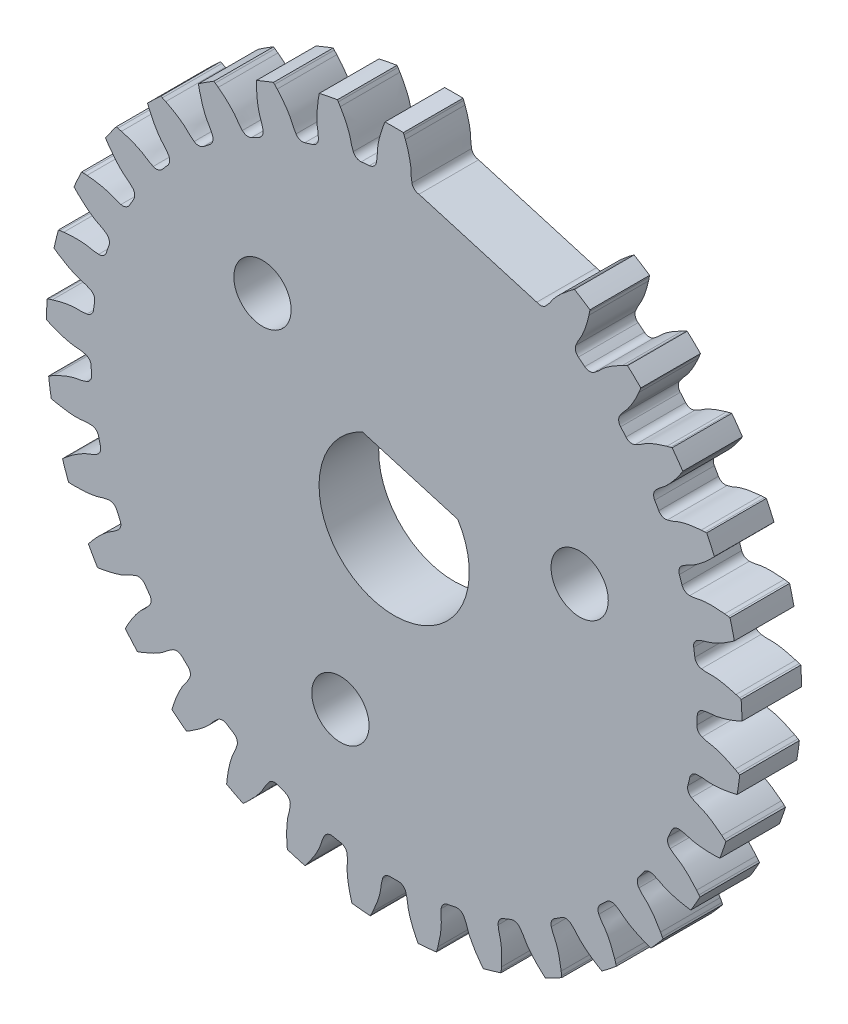
from build123d import *

# Parameters (mm, degrees)
SKETCH1_R           = 1.524
BOSS_EXTRUDE1_DEPTH = 3.175


with BuildPart() as part:
    # Sketch1 → Boss-Extrude1 (new body)
    with BuildSketch(Plane.XY):
        with BuildLine():
            Line((1.317722718, 16.087824145), (7.589195504, 14.246353585))
            ThreePointArc((7.589195504, 14.246353585), (7.848909294, 14.203144005), (8.081908957, 14.325738774))
            add(Edge.make_bspline(
                [(8.081908957, 14.325738774), (8.135763516, 14.382193351), (8.188276052, 14.439723268), (8.286040148, 14.560601191), (8.329833372, 14.625117736), (8.41657454, 14.754828132), (8.460564791, 14.819186802), (8.558645399, 14.93981111), (8.611251956, 14.997265689), (8.880827661, 15.279295862), (9.114602467, 15.484439301), (9.364156602, 15.671733637)],
                knots=[0, 0, 0, 0, 0.125, 0.125, 0.25, 0.25, 0.375, 0.375, 0.5, 0.5, 1, 1, 1, 1], degree=3))
            add(Edge.make_bspline(
                [(9.524985691, 15.789047753), (9.480902248, 15.75776951), (9.422419075, 15.715460547), (9.364156602, 15.671733637)],
                knots=[0.5, 0.5, 0.5, 0.5, 1, 1, 1, 1], degree=3))
            add(Edge.make_bspline(
                [(9.597666219, 15.840014852), (9.569069134, 15.820325996), (9.524985691, 15.789047753)],
                knots=[0, 0, 0, 0.5, 0.5, 0.5], degree=2))
            ThreePointArc((9.597666219, 15.840014852), (10.013118473, 15.580716473), (10.421569679, 15.310524249))
            add(Edge.make_bspline(
                [(10.421569679, 15.310524249), (10.415539725, 15.276332379), (10.405400958, 15.223239217)],
                knots=[0, 0, 0, 0.5, 0.5, 0.5], degree=2))
            add(Edge.make_bspline(
                [(10.405400958, 15.223239217), (10.395262191, 15.170146055), (10.381071393, 15.099372112), (10.365499102, 15.028209887)],
                knots=[0.5, 0.5, 0.5, 0.5, 1, 1, 1, 1], degree=3))
            add(Edge.make_bspline(
                [(10.365499102, 15.028209887), (10.298797583, 14.723397404), (10.209249565, 14.425372226), (10.064716198, 14.063080733), (10.034311357, 13.991375238), (9.965335513, 13.852067605), (9.925065558, 13.785319161), (9.843110552, 13.652533336), (9.802619615, 13.585895932), (9.733288872, 13.44676663), (9.702778631, 13.375114097), (9.673804032, 13.30268993)],
                knots=[0, 0, 0, 0, 0.5, 0.5, 0.625, 0.625, 0.75, 0.75, 0.875, 0.875, 1, 1, 1, 1], degree=3))
            ThreePointArc((9.673804032, 13.30268993), (9.659079466, 13.039818274), (9.806273289, 12.82152421))
            ThreePointArc((9.806273289, 12.82152421), (9.978136908, 12.68823324), (10.148188999, 12.552638724))
            ThreePointArc((10.148188999, 12.552638724), (10.395031955, 12.46105884), (10.647022223, 12.537342685))
            add(Edge.make_bspline(
                [(10.647022223, 12.537342685), (10.710587659, 12.582585012), (10.773038833, 12.629137225), (10.891912502, 12.729328749), (10.947124161, 12.784391475), (11.056845658, 12.895341961), (11.112220906, 12.950212376), (11.23135737, 13.050094969), (11.293886608, 13.096555413), (11.61196529, 13.322471395), (11.880339132, 13.479665452), (12.160829185, 13.616346705)],
                knots=[0, 0, 0, 0, 0.125, 0.125, 0.25, 0.25, 0.375, 0.375, 0.5, 0.5, 1, 1, 1, 1], degree=3))
            add(Edge.make_bspline(
                [(12.340953725, 13.701103697), (12.291747481, 13.678733539), (12.226314152, 13.648257167), (12.160829185, 13.616346705)],
                knots=[0.5, 0.5, 0.5, 0.5, 1, 1, 1, 1], degree=3))
            add(Edge.make_bspline(
                [(12.421966409, 13.737394873), (12.39015997, 13.723473855), (12.340953725, 13.701103697)],
                knots=[0, 0, 0, 0.5, 0.5, 0.5], degree=2))
            ThreePointArc((12.421966409, 13.737394873), (12.780838358, 13.404157497), (13.130774104, 13.061548101))
            add(Edge.make_bspline(
                [(13.130774104, 13.061548101), (13.118382265, 13.029115299), (13.098378772, 12.978900373)],
                knots=[0, 0, 0, 0.5, 0.5, 0.5], degree=2))
            add(Edge.make_bspline(
                [(13.098378772, 12.978900373), (13.078375279, 12.928685448), (13.05104687, 12.861876109), (13.022288452, 12.794946953)],
                knots=[0.5, 0.5, 0.5, 0.5, 1, 1, 1, 1], degree=3))
            add(Edge.make_bspline(
                [(13.022288452, 12.794946953), (12.899106174, 12.508266174), (12.754774769, 12.232573774), (12.544289193, 11.904182479), (12.500863453, 11.839526949), (12.40676995, 11.715790551), (12.354595499, 11.657869478), (12.248991644, 11.542993353), (12.19662122, 11.485223133), (12.102212979, 11.361729009), (12.058693767, 11.297145431), (12.016536413, 11.231513542)],
                knots=[0, 0, 0, 0, 0.5, 0.5, 0.625, 0.625, 0.75, 0.75, 0.875, 0.875, 1, 1, 1, 1], degree=3))
            ThreePointArc((12.016536413, 11.231513542), (11.952329151, 10.976178962), (12.055550567, 10.733973142))
            ThreePointArc((12.055550567, 10.733973142), (12.199082904, 10.570565509), (12.340400502, 10.405238793))
            ThreePointArc((12.340400502, 10.405238793), (12.565451077, 10.26859854), (12.827324365, 10.295814365))
            add(Edge.make_bspline(
                [(12.827324365, 10.295814365), (12.898303258, 10.328209266), (12.968435922, 10.362101258), (13.10412276, 10.437985201), (13.168757362, 10.481603996), (13.297493565, 10.569784533), (13.362252405, 10.613183534), (13.498138823, 10.688714394), (13.568330773, 10.722501501), (13.92341624, 10.8841381), (14.216689388, 10.987701373), (14.517977717, 11.068829526)],
                knots=[0, 0, 0, 0, 0.125, 0.125, 0.25, 0.25, 0.375, 0.375, 0.5, 0.5, 1, 1, 1, 1], degree=3))
            add(Edge.make_bspline(
                [(14.710887538, 11.117966055), (14.658336935, 11.105312498), (14.58831838, 11.087770213), (14.517977717, 11.068829526)],
                knots=[0.5, 0.5, 0.5, 0.5, 1, 1, 1, 1], degree=3))
            add(Edge.make_bspline(
                [(14.797304367, 11.138269651), (14.763438142, 11.130619612), (14.710887538, 11.117966055)],
                knots=[0, 0, 0, 0.5, 0.5, 0.5], degree=2))
            ThreePointArc((14.797304367, 11.138269651), (15.086625445, 10.743137346), (15.365398141, 10.340493572))
            add(Edge.make_bspline(
                [(15.365398141, 10.340493572), (15.347092291, 10.310992044), (15.31794705, 10.265470254)],
                knots=[0, 0, 0, 0.5, 0.5, 0.5], degree=2))
            add(Edge.make_bspline(
                [(15.31794705, 10.265470254), (15.288801809, 10.219948464), (15.24932351, 10.159518391), (15.208418367, 10.0992413)],
                knots=[0.5, 0.5, 0.5, 0.5, 1, 1, 1, 1], degree=3))
            add(Edge.make_bspline(
                [(15.208418367, 10.0992413), (15.03320746, 9.841053615), (14.839309181, 9.597658233), (14.570478893, 9.315036054), (14.515601773, 9.259767309), (14.399791394, 9.156074302), (14.337598169, 9.109074018), (14.212162263, 9.016259514), (14.149805155, 8.969444446), (14.033731578, 8.866048899), (13.978776292, 8.810868495), (13.924959859, 8.754400992)],
                knots=[0, 0, 0, 0, 0.5, 0.5, 0.625, 0.625, 0.75, 0.75, 0.875, 0.875, 1, 1, 1, 1], degree=3))
            ThreePointArc((13.924959859, 8.754400992), (13.813590519, 8.515831944), (13.869108836, 8.258468317))
            ThreePointArc((13.869108836, 8.258468317), (13.97912226, 8.070849999), (14.086597777, 7.881766421))
            ThreePointArc((14.086597777, 7.881766421), (14.281722058, 7.705004334), (14.544013583, 7.682168489))
            add(Edge.make_bspline(
                [(14.544013583, 7.682168489), (14.619840571, 7.700545128), (14.695119948, 7.720551954), (14.842715878, 7.769385672), (14.91443736, 7.79998404), (15.057535409, 7.862207553), (15.129337287, 7.892566586), (15.277062369, 7.941015831), (15.352380112, 7.960908447), (15.731638649, 8.052423697), (16.039211447, 8.098613138), (16.350408708, 8.121256008)],
                knots=[0, 0, 0, 0, 0.125, 0.125, 0.25, 0.25, 0.375, 0.375, 0.5, 0.5, 1, 1, 1, 1], degree=3))
            add(Edge.make_bspline(
                [(16.549131547, 8.132996152), (16.495135899, 8.130516528), (16.423062772, 8.126542354), (16.350408708, 8.121256008)],
                knots=[0.5, 0.5, 0.5, 0.5, 1, 1, 1, 1], degree=3))
            add(Edge.make_bspline(
                [(16.637829192, 8.136578344), (16.603127194, 8.135475776), (16.549131547, 8.132996152)],
                knots=[0, 0, 0, 0.5, 0.5, 0.5], degree=2))
            ThreePointArc((16.637829192, 8.136578344), (16.847142581, 7.69383222), (17.044676656, 7.245706664))
            add(Edge.make_bspline(
                [(17.044676656, 7.245706664), (17.021118415, 7.220202672), (16.983884811, 7.181019293)],
                knots=[0, 0, 0, 0.5, 0.5, 0.5], degree=2))
            add(Edge.make_bspline(
                [(16.983884811, 7.181019293), (16.946651207, 7.141835914), (16.896449866, 7.089969209), (16.844876418, 7.038522752)],
                knots=[0.5, 0.5, 0.5, 0.5, 1, 1, 1, 1], degree=3))
            add(Edge.make_bspline(
                [(16.844876418, 7.038522752), (16.623969459, 6.818159737), (16.387512296, 6.615858318), (16.070053522, 6.389219956), (16.005708425, 6.345335553), (15.87236686, 6.265433671), (15.802402685, 6.231052889), (15.661668309, 6.163654566), (15.591578265, 6.129486667), (15.458034552, 6.049926681), (15.39362942, 6.006143816), (15.330098975, 5.96088158)],
                knots=[0, 0, 0, 0, 0.5, 0.5, 0.625, 0.625, 0.75, 0.75, 0.875, 0.875, 1, 1, 1, 1], degree=3))
            ThreePointArc((15.330098975, 5.96088158), (15.175592735, 5.747700572), (15.181401378, 5.484480931))
            ThreePointArc((15.181401378, 5.484480931), (15.253919716, 5.279432943), (15.323668708, 5.073426476))
            ThreePointArc((15.323668708, 5.073426476), (15.481814393, 4.862931198), (15.735044257, 4.790869028))
            add(Edge.make_bspline(
                [(15.735044257, 4.790869028), (15.812978754, 4.794563226), (15.890684051, 4.799961786), (16.044854573, 4.819980302), (16.121070733, 4.836452338), (16.273358691, 4.870469907), (16.349608501, 4.886691718), (16.503833078, 4.906308266), (16.581554433, 4.911587421), (16.971278649, 4.92967372), (17.282034615, 4.916819923), (17.591893328, 4.880159138)],
                knots=[0, 0, 0, 0, 0.125, 0.125, 0.25, 0.25, 0.375, 0.375, 0.5, 0.5, 1, 1, 1, 1], degree=3))
            add(Edge.make_bspline(
                [(17.789246823, 4.854078578), (17.735757675, 4.861862508), (17.664234886, 4.871600081), (17.591893328, 4.880159138)],
                knots=[0.5, 0.5, 0.5, 0.5, 1, 1, 1, 1], degree=3))
            add(Edge.make_bspline(
                [(17.87701952, 4.840809895), (17.84273597, 4.846294649), (17.789246823, 4.854078578)],
                knots=[0, 0, 0, 0.5, 0.5, 0.5], degree=2))
            ThreePointArc((17.87701952, 4.840809895), (17.998760088, 4.366451951), (18.107916146, 3.889041039))
            add(Edge.make_bspline(
                [(18.107916146, 3.889041039), (18.079956971, 3.868456363), (18.035980724, 3.837027585)],
                knots=[0, 0, 0, 0.5, 0.5, 0.5], degree=2))
            add(Edge.make_bspline(
                [(18.035980724, 3.837027585), (17.992004477, 3.805598806), (17.9328945, 3.764170067), (17.872516746, 3.723413653)],
                knots=[0.5, 0.5, 0.5, 0.5, 1, 1, 1, 1], degree=3))
            add(Edge.make_bspline(
                [(17.872516746, 3.723413653), (17.613897889, 3.548839802), (17.34342802, 3.394944045), (16.988814547, 3.232480802), (16.917327071, 3.201566837), (16.771273632, 3.148343943), (16.696067195, 3.127825274), (16.545120856, 3.088279082), (16.469831113, 3.06799327), (16.323643883, 3.01514435), (16.252116674, 2.984341449), (16.181168372, 2.951920377)],
                knots=[0, 0, 0, 0, 0.5, 0.5, 0.625, 0.625, 0.75, 0.75, 0.875, 0.875, 1, 1, 1, 1], degree=3))
            ThreePointArc((16.181168372, 2.951920377), (15.98910949, 2.771832327), (15.944998519, 2.512270114))
            ThreePointArc((15.944998519, 2.512270114), (15.977400768, 2.297203425), (16.006902326, 2.08171968))
            ThreePointArc((16.006902326, 2.08171968), (16.122353619, 1.845099057), (16.357369434, 1.726415078))
            add(Edge.make_bspline(
                [(16.357369434, 1.726415078), (16.434594684, 1.715293316), (16.51191743, 1.705888493), (16.667090418, 1.696368285), (16.745046606, 1.698118647), (16.90102039, 1.702700789), (16.978962264, 1.704199079), (17.134112258, 1.694273938), (17.211428174, 1.684748828), (17.597532421, 1.628752491), (17.900240025, 1.557320026), (18.197561087, 1.462680602)],
                knots=[0, 0, 0, 0, 0.125, 0.125, 0.25, 0.25, 0.375, 0.375, 0.5, 0.5, 1, 1, 1, 1], degree=3))
            add(Edge.make_bspline(
                [(18.386412369, 1.399721958), (18.335362958, 1.417488109), (18.266975527, 1.440585489), (18.197561087, 1.462680602)],
                knots=[0.5, 0.5, 0.5, 0.5, 1, 1, 1, 1], degree=3))
            add(Edge.make_bspline(
                [(18.470087785, 1.370081964), (18.437461779, 1.381955806), (18.386412369, 1.399721958)],
                knots=[0, 0, 0, 0.5, 0.5, 0.5], degree=2))
            ThreePointArc((18.470087785, 1.370081964), (18.499855511, 0.881256733), (18.516688368, 0.391815337))
            add(Edge.make_bspline(
                [(18.516688368, 0.391815337), (18.485338776, 0.376893962), (18.436209301, 0.354355702)],
                knots=[0, 0, 0, 0.5, 0.5, 0.5], degree=2))
            add(Edge.make_bspline(
                [(18.436209301, 0.354355702), (18.387079826, 0.331817442), (18.321197604, 0.302324011), (18.254197752, 0.273730684)],
                knots=[0.5, 0.5, 0.5, 0.5, 1, 1, 1, 1], degree=3))
            add(Edge.make_bspline(
                [(18.254197752, 0.273730684), (17.967214156, 0.15125555), (17.672507066, 0.051327649), (17.29355555, -0.041088631), (17.21750944, -0.057914846), (17.064022878, -0.082535137), (16.986292335, -0.088450096), (16.830589627, -0.098714854), (16.752821353, -0.104385398), (16.599274193, -0.128613154), (16.523210086, -0.145322792), (16.447408185, -0.163730919)],
                knots=[0, 0, 0, 0, 0.5, 0.5, 0.625, 0.625, 0.75, 0.75, 0.875, 0.875, 1, 1, 1, 1], degree=3))
            ThreePointArc((16.447408185, -0.163730919), (16.224738169, -0.304217162), (16.132301868, -0.550740691))
            ThreePointArc((16.132301868, -0.550740691), (16.123416929, -0.768053011), (16.111604787, -0.985225891))
            ThreePointArc((16.111604787, -0.985225891), (16.180188978, -1.239419771), (16.38849666, -1.400436011))
            add(Edge.make_bspline(
                [(16.38849666, -1.400436011), (16.462221543, -1.425971763), (16.536367091, -1.449840055), (16.686934191, -1.488554901), (16.763812867, -1.501589477), (16.917835177, -1.526608372), (16.994652093, -1.539887755), (17.14511998, -1.578995865), (17.219236057, -1.602980977), (17.58776552, -1.731036096), (17.871484121, -1.858465475), (18.145521576, -2.007663022)],
                knots=[0, 0, 0, 0, 0.125, 0.125, 0.25, 0.25, 0.375, 0.375, 0.5, 0.5, 1, 1, 1, 1], degree=3))
            add(Edge.make_bspline(
                [(18.319045067, -2.105224262), (18.272280452, -2.078118003), (18.209500078, -2.042495617), (18.145521576, -2.007663022)],
                knots=[0.5, 0.5, 0.5, 0.5, 1, 1, 1, 1], degree=3))
            add(Edge.make_bspline(
                [(18.395598953, -2.150164298), (18.365809682, -2.13233052), (18.319045067, -2.105224262)],
                knots=[0, 0, 0, 0.5, 0.5, 0.5], degree=2))
            ThreePointArc((18.395598953, -2.150164298), (18.332317955, -2.635789401), (18.256219227, -3.119571591))
            add(Edge.make_bspline(
                [(18.256219227, -3.119571591), (18.222612274, -3.128290368), (18.170105239, -3.141123518)],
                knots=[0, 0, 0, 0.5, 0.5, 0.5], degree=2))
            add(Edge.make_bspline(
                [(18.170105239, -3.141123518), (18.117598204, -3.153956668), (18.047324891, -3.170448823), (17.976124491, -3.185845626)],
                knots=[0.5, 0.5, 0.5, 0.5, 1, 1, 1, 1], degree=3))
            add(Edge.make_bspline(
                [(17.976124491, -3.185845626), (17.671148491, -3.251795471), (17.362855663, -3.294143862), (16.973262398, -3.313173013), (16.895406158, -3.315303336), (16.740033877, -3.310431183), (16.662588613, -3.301528649), (16.507757038, -3.282140979), (16.43032098, -3.272991305), (16.274963484, -3.267722243), (16.197111635, -3.26973469), (16.119195812, -3.273464554)],
                knots=[0, 0, 0, 0, 0.5, 0.5, 0.625, 0.625, 0.75, 0.75, 0.875, 0.875, 1, 1, 1, 1], degree=3))
            ThreePointArc((16.119195812, -3.273464554), (15.873962538, -3.36927145), (15.736541797, -3.593846292))
            ThreePointArc((15.736541797, -3.593846292), (15.686690793, -3.80555001), (15.633991875, -4.016562831))
            ThreePointArc((15.633991875, -4.016562831), (15.653230151, -4.27914274), (15.827300918, -4.476671694))
            add(Edge.make_bspline(
                [(15.827300918, -4.476671694), (15.894860823, -4.515698508), (15.963149361, -4.553167606), (16.103668684, -4.619677835), (16.176691252, -4.647026244), (16.323195322, -4.70074193), (16.396110916, -4.728319033), (16.536458394, -4.795196644), (16.604695885, -4.832774874), (16.94233095, -5.028260529), (17.196806217, -5.207081191), (17.437655637, -5.405444474)],
                knots=[0, 0, 0, 0, 0.125, 0.125, 0.25, 0.25, 0.375, 0.375, 0.5, 0.5, 1, 1, 1, 1], degree=3))
            add(Edge.make_bspline(
                [(17.589579747, -5.534082191), (17.548790122, -5.498615517), (17.493885853, -5.451755609), (17.437655637, -5.405444474)],
                knots=[0.5, 0.5, 0.5, 0.5, 1, 1, 1, 1], degree=3))
            add(Edge.make_bspline(
                [(17.656245247, -5.592698021), (17.630369371, -5.569548866), (17.589579747, -5.534082191)],
                knots=[0, 0, 0, 0.5, 0.5, 0.5], degree=2))
            ThreePointArc((17.656245247, -5.592698021), (17.502202663, -6.057571237), (17.335922757, -6.518209075))
            add(Edge.make_bspline(
                [(17.335922757, -6.518209075), (17.301273086, -6.520410135), (17.247286232, -6.523074351)],
                knots=[0, 0, 0, 0.5, 0.5, 0.5], degree=2))
            add(Edge.make_bspline(
                [(17.247286232, -6.523074351), (17.193299378, -6.525738568), (17.121174834, -6.528633375), (17.048347254, -6.530277174)],
                knots=[0.5, 0.5, 0.5, 0.5, 1, 1, 1, 1], degree=3))
            add(Edge.make_bspline(
                [(17.048347254, -6.530277174), (16.736401478, -6.537318132), (16.425665417, -6.52055643), (16.039511319, -6.46551069), (15.962658877, -6.452868125), (15.811016436, -6.418679621), (15.736655525, -6.395281354), (15.588291099, -6.346941976), (15.513985998, -6.323302779), (15.362433191, -6.288727336), (15.285607368, -6.275969856), (15.208393704, -6.26488665)],
                knots=[0, 0, 0, 0, 0.5, 0.5, 0.625, 0.625, 0.75, 0.75, 0.875, 0.875, 1, 1, 1, 1], degree=3))
            ThreePointArc((15.208393704, -6.26488665), (14.94946054, -6.312551488), (14.772022103, -6.507060925))
            ThreePointArc((14.772022103, -6.507060925), (14.683006779, -6.705504515), (14.59132576, -6.902730723))
            ThreePointArc((14.59132576, -6.902730723), (14.560522802, -7.164206339), (14.694065283, -7.391108799))
            add(Edge.make_bspline(
                [(14.694065283, -7.391108799), (14.753018419, -7.442216143), (14.812981821, -7.491931816), (14.938374633, -7.583833575), (15.004901868, -7.624507375), (15.138592658, -7.704978426), (15.204971572, -7.745856542), (15.330126116, -7.838086522), (15.39001874, -7.887899694), (15.684556396, -8.143750526), (15.900590931, -8.367499426), (16.09954739, -8.607859078)],
                knots=[0, 0, 0, 0, 0.125, 0.125, 0.25, 0.25, 0.375, 0.375, 0.5, 0.5, 1, 1, 1, 1], degree=3))
            add(Edge.make_bspline(
                [(16.224381185, -8.762923971), (16.191040795, -8.720378739), (16.145997012, -8.66397495), (16.09954739, -8.607859078)],
                knots=[0.5, 0.5, 0.5, 0.5, 1, 1, 1, 1], degree=3))
            add(Edge.make_bspline(
                [(16.278748834, -8.833097066), (16.257721575, -8.805469204), (16.224381185, -8.762923971)],
                knots=[0, 0, 0, 0.5, 0.5, 0.5], degree=2))
            ThreePointArc((16.278748834, -8.833097066), (16.039512166, -9.260416667), (15.78906087, -9.681261499))
            add(Edge.make_bspline(
                [(15.78906087, -9.681261499), (15.754620811, -9.67686529), (15.701105363, -9.669264281)],
                knots=[0, 0, 0, 0.5, 0.5, 0.5], degree=2))
            add(Edge.make_bspline(
                [(15.701105363, -9.669264281), (15.647589916, -9.661663272), (15.57622091, -9.650856107), (15.504398329, -9.63868749)],
                knots=[0.5, 0.5, 0.5, 0.5, 1, 1, 1, 1], degree=3))
            add(Edge.make_bspline(
                [(15.504398329, -9.63868749), (15.196757308, -9.586565083), (14.894808826, -9.511299101), (14.526050511, -9.384167965), (14.452979513, -9.357209447), (14.310547666, -9.294940254), (14.241958704, -9.257891929), (14.105423704, -9.182347954), (14.036935141, -9.145073616), (13.894664536, -9.082441439), (13.821641425, -9.05537512), (13.747920623, -9.02987942)],
                knots=[0, 0, 0, 0, 0.5, 0.5, 0.625, 0.625, 0.75, 0.75, 0.875, 0.875, 1, 1, 1, 1], degree=3))
            ThreePointArc((13.747920623, -9.02987942), (13.484646089, -9.027679469), (13.273603043, -9.185093422))
            ThreePointArc((13.273603043, -9.185093422), (13.148640646, -9.363104618), (13.021291117, -9.539415945))
            ThreePointArc((13.021291117, -9.539415945), (12.941560222, -9.790336857), (13.029747843, -10.038411973))
            add(Edge.make_bspline(
                [(13.029747843, -10.038411973), (13.077963491, -10.099752695), (13.127434523, -10.15991809), (13.233168801, -10.273889811), (13.290796236, -10.326418944), (13.406841812, -10.430736926), (13.464284938, -10.483438614), (13.569723138, -10.597687531), (13.61910622, -10.657935268), (13.859901109, -10.96490416), (14.02968686, -11.225494431), (14.179559553, -11.499163228)],
                knots=[0, 0, 0, 0, 0.125, 0.125, 0.25, 0.25, 0.375, 0.375, 0.5, 0.5, 1, 1, 1, 1], degree=3))
            add(Edge.make_bspline(
                [(14.272791215, -11.675050848), (14.248105067, -11.626964752), (14.214549772, -11.563055661), (14.179559553, -11.499163228)],
                knots=[0.5, 0.5, 0.5, 0.5, 1, 1, 1, 1], degree=3))
            add(Edge.make_bspline(
                [(14.312896024, -11.754244968), (14.297477363, -11.723136943), (14.272791215, -11.675050848)],
                knots=[0, 0, 0, 0.5, 0.5, 0.5], degree=2))
            ThreePointArc((14.312896024, -11.754244968), (13.997111908, -12.12856651), (13.671541185, -12.494407908))
            add(Edge.make_bspline(
                [(13.671541185, -12.494407908), (13.638555491, -12.48357332), (13.587445638, -12.465981807)],
                knots=[0, 0, 0, 0.5, 0.5, 0.5], degree=2))
            add(Edge.make_bspline(
                [(13.587445638, -12.465981807), (13.536335784, -12.448390293), (13.468301779, -12.424271754), (13.400080051, -12.398730527)],
                knots=[0.5, 0.5, 0.5, 0.5, 1, 1, 1, 1], degree=3))
            add(Edge.make_bspline(
                [(13.400080051, -12.398730527), (13.107862735, -12.289328594), (12.825615036, -12.15827864), (12.48758039, -11.96365696), (12.420931814, -11.92335684), (12.292858418, -11.835257528), (12.232520389, -11.785898168), (12.112749546, -11.685879953), (12.052552875, -11.636317664), (11.924706503, -11.547892443), (11.858125349, -11.507495534), (11.790561871, -11.468508821)],
                knots=[0, 0, 0, 0, 0.5, 0.5, 0.625, 0.625, 0.75, 0.75, 0.875, 0.875, 1, 1, 1, 1], degree=3))
            ThreePointArc((11.790561871, -11.468508821), (11.532461394, -11.416523592), (11.295441383, -11.53115271))
            ThreePointArc((11.295441383, -11.53115271), (11.139048379, -11.682297722), (10.980633084, -11.831321816))
            ThreePointArc((10.980633084, -11.831321816), (10.854855936, -12.062619091), (10.894501368, -12.322900785))
            add(Edge.make_bspline(
                [(10.894501368, -12.322900785), (10.930236888, -12.392257871), (10.967427539, -12.460698453), (11.049681771, -12.5926209), (11.096326598, -12.655106827), (11.190532772, -12.779501417), (11.236963966, -12.8421219), (11.318875011, -12.974260501), (11.355963716, -13.042765293), (11.534312883, -13.389757589), (11.651713352, -13.677770819), (11.74708549, -13.974857658)],
                knots=[0, 0, 0, 0, 0.125, 0.125, 0.25, 0.25, 0.375, 0.375, 0.5, 0.5, 1, 1, 1, 1], degree=3))
            add(Edge.make_bspline(
                [(11.805345383, -14.165210967), (11.790205699, -14.113321966), (11.769351667, -14.044217414), (11.74708549, -13.974857658)],
                knots=[0.5, 0.5, 0.5, 0.5, 1, 1, 1, 1], degree=3))
            add(Edge.make_bspline(
                [(11.82973786, -14.250563832), (11.820485067, -14.217099968), (11.805345383, -14.165210967)],
                knots=[0, 0, 0, 0.5, 0.5, 0.5], degree=2))
            ThreePointArc((11.82973786, -14.250563832), (11.448819557, -14.558358359), (11.059896381, -14.855973862))
            add(Edge.make_bspline(
                [(11.059896381, -14.855973862), (11.029557241, -14.839092485), (10.982700225, -14.81214627)],
                knots=[0, 0, 0, 0.5, 0.5, 0.5], degree=2))
            add(Edge.make_bspline(
                [(10.982700225, -14.81214627), (10.935843209, -14.785200055), (10.873603131, -14.748641849), (10.811447967, -14.710651138)],
                knots=[0.5, 0.5, 0.5, 0.5, 1, 1, 1, 1], degree=3))
            add(Edge.make_bspline(
                [(10.811447967, -14.710651138), (10.545215851, -14.54792375), (10.292870102, -14.365826311), (9.997776578, -14.110748221), (9.939959276, -14.058563051), (9.830873237, -13.947817758), (9.780966916, -13.88793134), (9.682289059, -13.767053803), (9.632559946, -13.706994874), (9.523758507, -13.595972527), (9.466025727, -13.543705077), (9.407061492, -13.492636432)],
                knots=[0, 0, 0, 0, 0.5, 0.5, 0.625, 0.625, 0.75, 0.75, 0.875, 0.875, 1, 1, 1, 1], degree=3))
            ThreePointArc((9.407061492, -13.492636432), (9.163463497, -13.392744808), (8.909033044, -13.460446097))
            ThreePointArc((8.909033044, -13.460446097), (8.726861883, -13.579262151), (8.543106363, -13.695612895))
            ThreePointArc((8.543106363, -13.695612895), (8.375828875, -13.898926844), (8.365499228, -14.162007855))
            add(Edge.make_bspline(
                [(8.365499228, -14.162007855), (8.387463046, -14.23687456), (8.411029148, -14.311116708), (8.466830451, -14.456221861), (8.500806807, -14.526406177), (8.569768721, -14.666381431), (8.603509838, -14.736657441), (8.658933249, -14.881909892), (8.682387097, -14.956195797), (8.791844538, -15.330670292), (8.852616565, -15.635696932), (8.89004115, -15.945464321)],
                knots=[0, 0, 0, 0, 0.125, 0.125, 0.25, 0.25, 0.375, 0.375, 0.5, 0.5, 1, 1, 1, 1], degree=3))
            add(Edge.make_bspline(
                [(8.91122361, -16.143403455), (8.906177579, -16.089586952), (8.898778528, -16.017784558), (8.89004115, -15.945464321)],
                knots=[0.5, 0.5, 0.5, 0.5, 1, 1, 1, 1], degree=3))
            add(Edge.make_bspline(
                [(8.919022148, -16.231830189), (8.916269642, -16.197219959), (8.91122361, -16.143403455)],
                knots=[0, 0, 0, 0.5, 0.5, 0.5], degree=2))
            ThreePointArc((8.919022148, -16.231830189), (8.486737038, -16.461973205), (8.048518106, -16.680606214))
            add(Edge.make_bspline(
                [(8.048518106, -16.680606214), (8.021922055, -16.658288185), (7.981011411, -16.622961175)],
                knots=[0, 0, 0, 0.5, 0.5, 0.5], degree=2))
            add(Edge.make_bspline(
                [(7.981011411, -16.622961175), (7.940100767, -16.587634164), (7.885904134, -16.539957601), (7.832061985, -16.490890489)],
                knots=[0.5, 0.5, 0.5, 0.5, 1, 1, 1, 1], degree=3))
            add(Edge.make_bspline(
                [(7.832061985, -16.490890489), (7.60143739, -16.280719037), (7.388114025, -16.05415559), (7.146627071, -15.747840276), (7.099730711, -15.685656164), (7.013574684, -15.556267514), (6.975903814, -15.488018488), (6.901885419, -15.350650458), (6.864421203, -15.282265577), (6.778597065, -15.15265874), (6.731799271, -15.09040983), (6.683565402, -15.029105007)],
                knots=[0, 0, 0, 0, 0.5, 0.5, 0.625, 0.625, 0.75, 0.75, 0.875, 0.875, 1, 1, 1, 1], degree=3))
            ThreePointArc((6.683565402, -15.029105007), (6.463274153, -14.884917331), (6.200629036, -14.903243889))
            ThreePointArc((6.200629036, -14.903243889), (5.99926386, -14.985436664), (5.79680952, -15.064908837))
            ThreePointArc((5.79680952, -15.064908837), (5.594077536, -15.232891165), (5.53414615, -15.489263062))
            add(Edge.make_bspline(
                [(5.53414615, -15.489263062), (5.541544436, -15.566933508), (5.550634248, -15.644293918), (5.577965819, -15.797337298), (5.598045708, -15.87268336), (5.6392709, -16.023180206), (5.659102449, -16.098571786), (5.68603508, -16.251688286), (5.695006385, -16.329070417), (5.731616024, -16.717492627), (5.73356315, -17.02850822), (5.71168756, -17.339760358)],
                knots=[0, 0, 0, 0, 0.125, 0.125, 0.25, 0.25, 0.375, 0.375, 0.5, 0.5, 1, 1, 1, 1], degree=3))
            add(Edge.make_bspline(
                [(5.695026999, -17.538131281), (5.700256996, -17.484332345), (5.706580348, -17.412427234), (5.71168756, -17.339760358)],
                knots=[0.5, 0.5, 0.5, 0.5, 1, 1, 1, 1], degree=3))
            add(Edge.make_bspline(
                [(5.685949737, -17.626435912), (5.689797002, -17.591930218), (5.695026999, -17.538131281)],
                knots=[0, 0, 0, 0.5, 0.5, 0.5], degree=2))
            ThreePointArc((5.685949737, -17.626435912), (5.21792173, -17.770609449), (4.746245416, -17.902357996))
            add(Edge.make_bspline(
                [(4.746245416, -17.902357996), (4.724353705, -17.875409947), (4.69086805, -17.832978952)],
                knots=[0, 0, 0, 0.5, 0.5, 0.5], degree=2))
            add(Edge.make_bspline(
                [(4.69086805, -17.832978952), (4.657382396, -17.790547956), (4.613188015, -17.73347619), (4.569604876, -17.675106091)],
                knots=[0.5, 0.5, 0.5, 0.5, 1, 1, 1, 1], degree=3))
            add(Edge.make_bspline(
                [(4.569604876, -17.675106091), (4.382923177, -17.42508672), (4.216332257, -17.162245857), (4.037179841, -16.815764353), (4.00289938, -16.745828794), (3.942787268, -16.602473231), (3.918713373, -16.528328295), (3.872029657, -16.379434611), (3.848184392, -16.305195383), (3.788439463, -16.161688386), (3.75426805, -16.091707854), (3.718507844, -16.02238257)],
                knots=[0, 0, 0, 0, 0.5, 0.5, 0.625, 0.625, 0.75, 0.75, 0.875, 0.875, 1, 1, 1, 1], degree=3))
            ThreePointArc((3.718507844, -16.02238257), (3.529485242, -15.839110161), (3.268118142, -15.80739962))
            ThreePointArc((3.268118142, -15.80739962), (3.054836811, -15.849998454), (2.841000876, -15.889719726))
            ThreePointArc((2.841000876, -15.889719726), (2.610141659, -16.016299114), (2.502774611, -16.256695945))
            add(Edge.make_bspline(
                [(2.502774611, -16.256695945), (2.495339971, -16.33436292), (2.489624965, -16.412045585), (2.487498969, -16.567495805), (2.492956652, -16.64528041), (2.504955136, -16.800859501), (2.510160353, -16.878641802), (2.507628787, -17.034088321), (2.501793305, -17.111769887), (2.464231974, -17.500101221), (2.407283824, -17.805864854), (2.326898701, -18.107352277)],
                knots=[0, 0, 0, 0, 0.125, 0.125, 0.25, 0.25, 0.375, 0.375, 0.5, 0.5, 1, 1, 1, 1], degree=3))
            add(Edge.make_bspline(
                [(2.272997273, -18.298985348), (2.288314273, -18.247148411), (2.308131486, -18.177739422), (2.326898701, -18.107352277)],
                knots=[0.5, 0.5, 0.5, 0.5, 1, 1, 1, 1], degree=3))
            add(Edge.make_bspline(
                [(2.247372288, -18.383976315), (2.257680273, -18.350822284), (2.272997273, -18.298985348)],
                knots=[0, 0, 0, 0.5, 0.5, 0.5], degree=2))
            ThreePointArc((2.247372288, -18.383976315), (1.760517135, -18.436969566), (1.272431051, -18.477071916))
            add(Edge.make_bspline(
                [(1.272431051, -18.477071916), (1.256034903, -18.44646782), (1.231184496, -18.398466406)],
                knots=[0, 0, 0, 0.5, 0.5, 0.5], degree=2))
            add(Edge.make_bspline(
                [(1.231184496, -18.398466406), (1.20633409, -18.350464992), (1.173739262, -18.286060746), (1.141990341, -18.220497307)],
                knots=[0.5, 0.5, 0.5, 0.5, 1, 1, 1, 1], degree=3))
            add(Edge.make_bspline(
                [(1.141990341, -18.220497307), (1.005998701, -17.939666368), (0.892161256, -17.650047842), (0.781818413, -17.275922893), (0.761392837, -17.200763541), (0.729497247, -17.048622308), (0.71989042, -16.971261252), (0.702228655, -16.81622332), (0.692864171, -16.738812946), (0.661357789, -16.586592505), (0.641047801, -16.51140963), (0.619053724, -16.436569481)],
                knots=[0, 0, 0, 0, 0.5, 0.5, 0.625, 0.625, 0.75, 0.75, 0.875, 0.875, 1, 1, 1, 1], degree=3))
            ThreePointArc((0.619053724, -16.436569481), (0.468131539, -16.22083628), (0.217488941, -16.14023474))
            ThreePointArc((0.217488941, -16.14023474), (0, -16.141700001), (-0.217488941, -16.14023474))
            ThreePointArc((-0.217488941, -16.14023474), (-0.468131539, -16.22083628), (-0.619053724, -16.436569481))
            add(Edge.make_bspline(
                [(-0.619053724, -16.436569481), (-0.641052581, -16.511425898), (-0.661365851, -16.586623164), (-0.692872575, -16.738861848), (-0.702234352, -16.816273657), (-0.719896234, -16.971311959), (-0.729505479, -17.048673726), (-0.761409743, -17.200832022), (-0.781841103, -17.276005409), (-0.892215841, -17.650210561), (-1.006001011, -17.939671139), (-1.141990341, -18.220497307)],
                knots=[0, 0, 0, 0, 0.125, 0.125, 0.25, 0.25, 0.375, 0.375, 0.5, 0.5, 1, 1, 1, 1], degree=3))
            add(Edge.make_bspline(
                [(-1.231184496, -18.398466406), (-1.20633409, -18.350464992), (-1.173739262, -18.286060746), (-1.141990341, -18.220497307)],
                knots=[0.5, 0.5, 0.5, 0.5, 1, 1, 1, 1], degree=3))
            add(Edge.make_bspline(
                [(-1.272431051, -18.477071916), (-1.256034903, -18.44646782), (-1.231184496, -18.398466406)],
                knots=[0, 0, 0, 0.5, 0.5, 0.5], degree=2))
            ThreePointArc((-1.272431051, -18.477071916), (-1.760517135, -18.436969566), (-2.247372288, -18.383976315))
            add(Edge.make_bspline(
                [(-2.247372288, -18.383976315), (-2.257680273, -18.350822284), (-2.272997273, -18.298985348)],
                knots=[0, 0, 0, 0.5, 0.5, 0.5], degree=2))
            add(Edge.make_bspline(
                [(-2.272997273, -18.298985348), (-2.288314273, -18.247148411), (-2.308131486, -18.177739422), (-2.326898701, -18.107352277)],
                knots=[0.5, 0.5, 0.5, 0.5, 1, 1, 1, 1], degree=3))
            add(Edge.make_bspline(
                [(-2.326898701, -18.107352277), (-2.40728519, -17.805859732), (-2.464254777, -17.499931112), (-2.501799969, -17.111684568), (-2.507632428, -17.034017878), (-2.510158705, -16.878589754), (-2.504951248, -16.80080861), (-2.49295272, -16.645229904), (-2.487497966, -16.567446196), (-2.48962708, -16.412013955), (-2.495341587, -16.334346042), (-2.502774611, -16.256695945)],
                knots=[0, 0, 0, 0, 0.5, 0.5, 0.625, 0.625, 0.75, 0.75, 0.875, 0.875, 1, 1, 1, 1], degree=3))
            ThreePointArc((-2.502774611, -16.256695945), (-2.610141659, -16.016299113), (-2.841000876, -15.889719724))
            ThreePointArc((-2.841000876, -15.889719724), (-3.054836811, -15.849998453), (-3.26811814, -15.807399619))
            ThreePointArc((-3.26811814, -15.807399619), (-3.529485242, -15.839110161), (-3.718507844, -16.02238257))
            add(Edge.make_bspline(
                [(-3.718507844, -16.02238257), (-3.754275823, -16.091722923), (-3.788453182, -16.161716965), (-3.848201899, -16.305241811), (-3.872044778, -16.37948296), (-3.918728678, -16.528376985), (-3.942805082, -16.602522162), (-4.002928941, -16.745892838), (-4.037217737, -16.815841083), (-4.21641665, -17.162395305), (-4.382926349, -17.425090967), (-4.569604876, -17.675106091)],
                knots=[0, 0, 0, 0, 0.125, 0.125, 0.25, 0.25, 0.375, 0.375, 0.5, 0.5, 1, 1, 1, 1], degree=3))
            add(Edge.make_bspline(
                [(-4.69086805, -17.832978952), (-4.657382396, -17.790547956), (-4.613188015, -17.73347619), (-4.569604876, -17.675106091)],
                knots=[0.5, 0.5, 0.5, 0.5, 1, 1, 1, 1], degree=3))
            add(Edge.make_bspline(
                [(-4.746245416, -17.902357996), (-4.724353705, -17.875409947), (-4.69086805, -17.832978952)],
                knots=[0, 0, 0, 0.5, 0.5, 0.5], degree=2))
            ThreePointArc((-4.746245416, -17.902357996), (-5.21792173, -17.770609449), (-5.685949737, -17.626435912))
            add(Edge.make_bspline(
                [(-5.685949737, -17.626435912), (-5.689797002, -17.591930218), (-5.695026999, -17.538131281)],
                knots=[0, 0, 0, 0.5, 0.5, 0.5], degree=2))
            add(Edge.make_bspline(
                [(-5.695026999, -17.538131281), (-5.700256996, -17.484332345), (-5.706580348, -17.412427234), (-5.71168756, -17.339760358)],
                knots=[0.5, 0.5, 0.5, 0.5, 1, 1, 1, 1], degree=3))
            add(Edge.make_bspline(
                [(-5.71168756, -17.339760358), (-5.733563522, -17.028502932), (-5.731606222, -16.717321276), (-5.694996782, -16.328985379), (-5.686025323, -16.251618427), (-5.659090981, -16.098520991), (-5.639257451, -16.023130971), (-5.598032289, -15.872634511), (-5.577955446, -15.797288775), (-5.550630338, -15.64426246), (-5.541542828, -15.566916629), (-5.53414615, -15.489263062)],
                knots=[0, 0, 0, 0, 0.5, 0.5, 0.625, 0.625, 0.75, 0.75, 0.875, 0.875, 1, 1, 1, 1], degree=3))
            ThreePointArc((-5.53414615, -15.489263062), (-5.594077536, -15.232891166), (-5.79680952, -15.064908837))
            ThreePointArc((-5.79680952, -15.064908837), (-5.999263861, -14.985436664), (-6.200629037, -14.90324389))
            ThreePointArc((-6.200629037, -14.90324389), (-6.463274154, -14.884917331), (-6.683565402, -15.029105007))
            add(Edge.make_bspline(
                [(-6.683565402, -15.029105007), (-6.731809755, -15.090423155), (-6.778615944, -15.152684206), (-6.86444718, -15.282307852), (-6.901909416, -15.350695072), (-6.975928057, -15.488063402), (-7.013601437, -15.55631219), (-7.099771858, -15.685713456), (-7.146678803, -15.747908448), (-7.388225176, -16.054286366), (-7.601441308, -16.280722608), (-7.832061985, -16.490890489)],
                knots=[0, 0, 0, 0, 0.125, 0.125, 0.25, 0.25, 0.375, 0.375, 0.5, 0.5, 1, 1, 1, 1], degree=3))
            add(Edge.make_bspline(
                [(-7.981011411, -16.622961175), (-7.940100767, -16.587634164), (-7.885904134, -16.539957601), (-7.832061985, -16.490890489)],
                knots=[0.5, 0.5, 0.5, 0.5, 1, 1, 1, 1], degree=3))
            add(Edge.make_bspline(
                [(-8.048518106, -16.680606214), (-8.021922055, -16.658288185), (-7.981011411, -16.622961175)],
                knots=[0, 0, 0, 0.5, 0.5, 0.5], degree=2))
            ThreePointArc((-8.048518106, -16.680606214), (-8.486737038, -16.461973205), (-8.919022148, -16.231830189))
            add(Edge.make_bspline(
                [(-8.919022148, -16.231830189), (-8.916269642, -16.197219959), (-8.91122361, -16.143403455)],
                knots=[0, 0, 0, 0.5, 0.5, 0.5], degree=2))
            add(Edge.make_bspline(
                [(-8.91122361, -16.143403455), (-8.906177579, -16.089586952), (-8.898778528, -16.017784558), (-8.89004115, -15.945464321)],
                knots=[0.5, 0.5, 0.5, 0.5, 1, 1, 1, 1], degree=3))
            add(Edge.make_bspline(
                [(-8.89004115, -15.945464321), (-8.852615929, -15.63569167), (-8.791802485, -15.330503893), (-8.682361573, -14.956114113), (-8.658910448, -14.881843142), (-8.603488965, -14.736609734), (-8.569746197, -14.66633563), (-8.500784385, -14.526360751), (-8.466811083, -14.456176178), (-8.411019355, -14.311086558), (-8.387458273, -14.23685829), (-8.365499228, -14.162007855)],
                knots=[0, 0, 0, 0, 0.5, 0.5, 0.625, 0.625, 0.75, 0.75, 0.875, 0.875, 1, 1, 1, 1], degree=3))
            ThreePointArc((-8.365499228, -14.162007855), (-8.375828875, -13.898926843), (-8.543106364, -13.695612894))
            ThreePointArc((-8.543106364, -13.695612894), (-8.726861883, -13.579262151), (-8.909033043, -13.460446097))
            ThreePointArc((-8.909033043, -13.460446097), (-9.163463496, -13.392744808), (-9.407061492, -13.492636432))
            add(Edge.make_bspline(
                [(-9.407061492, -13.492636432), (-9.466038543, -13.543716177), (-9.523781865, -13.59599396), (-9.632593454, -13.70703147), (-9.682321066, -13.767093068), (-9.780999221, -13.887970854), (-9.830907961, -13.947856564), (-9.940010522, -14.058611521), (-9.997840277, -14.11080537), (-10.293003994, -14.365933688), (-10.545220374, -14.547926514), (-10.811447967, -14.710651138)],
                knots=[0, 0, 0, 0, 0.125, 0.125, 0.25, 0.25, 0.375, 0.375, 0.5, 0.5, 1, 1, 1, 1], degree=3))
            add(Edge.make_bspline(
                [(-10.982700225, -14.81214627), (-10.935843209, -14.785200055), (-10.873603131, -14.748641849), (-10.811447967, -14.710651138)],
                knots=[0.5, 0.5, 0.5, 0.5, 1, 1, 1, 1], degree=3))
            add(Edge.make_bspline(
                [(-11.059896381, -14.855973862), (-11.029557241, -14.839092485), (-10.982700225, -14.81214627)],
                knots=[0, 0, 0, 0.5, 0.5, 0.5], degree=2))
            ThreePointArc((-11.059896381, -14.855973862), (-11.448819557, -14.558358359), (-11.82973786, -14.250563832))
            add(Edge.make_bspline(
                [(-11.82973786, -14.250563832), (-11.820485067, -14.217099968), (-11.805345383, -14.165210967)],
                knots=[0, 0, 0, 0.5, 0.5, 0.5], degree=2))
            add(Edge.make_bspline(
                [(-11.805345383, -14.165210967), (-11.790205699, -14.113321966), (-11.769351667, -14.044217414), (-11.74708549, -13.974857658)],
                knots=[0.5, 0.5, 0.5, 0.5, 1, 1, 1, 1], degree=3))
            add(Edge.make_bspline(
                [(-11.74708549, -13.974857658), (-11.651711732, -13.677765772), (-11.534240099, -13.389602155), (-11.355923195, -13.042689915), (-11.318839989, -12.974199272), (-11.236934441, -12.842079006), (-11.190501988, -12.779460707), (-11.096295985, -12.655066465), (-11.049654107, -12.592579709), (-10.967412217, -12.460670701), (-10.930229122, -12.392242799), (-10.894501368, -12.322900785)],
                knots=[0, 0, 0, 0, 0.5, 0.5, 0.625, 0.625, 0.75, 0.75, 0.875, 0.875, 1, 1, 1, 1], degree=3))
            ThreePointArc((-10.894501368, -12.322900785), (-10.854855936, -12.062619092), (-10.980633085, -11.831321818))
            ThreePointArc((-10.980633085, -11.831321818), (-11.13904838, -11.682297723), (-11.295441385, -11.53115271))
            ThreePointArc((-11.295441385, -11.53115271), (-11.532461395, -11.416523592), (-11.790561871, -11.468508821))
            add(Edge.make_bspline(
                [(-11.790561871, -11.468508821), (-11.858140035, -11.507504008), (-11.924733495, -11.547909068), (-12.052592704, -11.636347257), (-12.112788405, -11.685912452), (-12.232559588, -11.785930855), (-12.292899858, -11.83528906), (-12.420991307, -11.923394736), (-12.487653754, -11.963701021), (-12.82576683, -12.158358737), (-13.1078677, -12.289330452), (-13.400080051, -12.398730527)],
                knots=[0, 0, 0, 0, 0.125, 0.125, 0.25, 0.25, 0.375, 0.375, 0.5, 0.5, 1, 1, 1, 1], degree=3))
            add(Edge.make_bspline(
                [(-13.587445638, -12.465981807), (-13.536335784, -12.448390293), (-13.468301779, -12.424271754), (-13.400080051, -12.398730527)],
                knots=[0.5, 0.5, 0.5, 0.5, 1, 1, 1, 1], degree=3))
            add(Edge.make_bspline(
                [(-13.671541185, -12.494407908), (-13.638555491, -12.48357332), (-13.587445638, -12.465981807)],
                knots=[0, 0, 0, 0.5, 0.5, 0.5], degree=2))
            ThreePointArc((-13.671541185, -12.494407908), (-13.997111908, -12.12856651), (-14.312896024, -11.754244968))
            add(Edge.make_bspline(
                [(-14.312896024, -11.754244968), (-14.297477363, -11.723136943), (-14.272791215, -11.675050848)],
                knots=[0, 0, 0, 0.5, 0.5, 0.5], degree=2))
            add(Edge.make_bspline(
                [(-14.272791215, -11.675050848), (-14.248105067, -11.626964752), (-14.214549772, -11.563055661), (-14.179559553, -11.499163228)],
                knots=[0.5, 0.5, 0.5, 0.5, 1, 1, 1, 1], degree=3))
            add(Edge.make_bspline(
                [(-14.179559553, -11.499163228), (-14.029684314, -11.225489781), (-13.859800224, -10.96476531), (-13.619052166, -10.657868922), (-13.569677162, -10.597634037), (-13.464247829, -10.483402083), (-13.40680388, -10.430702778), (-13.290758537, -10.326385105), (-13.233133842, -10.273854599), (-13.127414226, -10.159893739), (-13.077953013, -10.099739365), (-13.029747843, -10.038411973)],
                knots=[0, 0, 0, 0, 0.5, 0.5, 0.625, 0.625, 0.75, 0.75, 0.875, 0.875, 1, 1, 1, 1], degree=3))
            ThreePointArc((-13.029747843, -10.038411973), (-12.941560222, -9.790336857), (-13.021291117, -9.539415944))
            ThreePointArc((-13.021291117, -9.539415944), (-13.148640645, -9.363104618), (-13.273603042, -9.185093422))
            ThreePointArc((-13.273603042, -9.185093422), (-13.484646089, -9.027679469), (-13.747920623, -9.02987942))
            add(Edge.make_bspline(
                [(-13.747920623, -9.02987942), (-13.821657449, -9.055380662), (-13.894694186, -9.082452655), (-14.036979851, -9.145095136), (-14.105468012, -9.182372512), (-14.242003381, -9.257916606), (-14.310594325, -9.294963374), (-14.453045103, -9.357235399), (-14.526130888, -9.384197346), (-14.894973035, -9.511349023), (-15.196762535, -9.586565968), (-15.504398329, -9.63868749)],
                knots=[0, 0, 0, 0, 0.125, 0.125, 0.25, 0.25, 0.375, 0.375, 0.5, 0.5, 1, 1, 1, 1], degree=3))
            add(Edge.make_bspline(
                [(-15.701105363, -9.669264281), (-15.647589916, -9.661663272), (-15.57622091, -9.650856107), (-15.504398329, -9.63868749)],
                knots=[0.5, 0.5, 0.5, 0.5, 1, 1, 1, 1], degree=3))
            add(Edge.make_bspline(
                [(-15.78906087, -9.681261499), (-15.754620811, -9.67686529), (-15.701105363, -9.669264281)],
                knots=[0, 0, 0, 0.5, 0.5, 0.5], degree=2))
            ThreePointArc((-15.78906087, -9.681261499), (-16.039512166, -9.260416667), (-16.278748834, -8.833097066))
            add(Edge.make_bspline(
                [(-16.278748834, -8.833097066), (-16.257721575, -8.805469204), (-16.224381185, -8.762923971)],
                knots=[0, 0, 0, 0.5, 0.5, 0.5], degree=2))
            add(Edge.make_bspline(
                [(-16.224381185, -8.762923971), (-16.191040795, -8.720378739), (-16.145997012, -8.66397495), (-16.09954739, -8.607859078)],
                knots=[0.5, 0.5, 0.5, 0.5, 1, 1, 1, 1], degree=3))
            add(Edge.make_bspline(
                [(-16.09954739, -8.607859078), (-15.900587551, -8.367495343), (-15.684431057, -8.143633277), (-15.389953107, -7.887844777), (-15.330070847, -7.838042695), (-15.204928219, -7.745827694), (-15.138548948, -7.704952073), (-15.004858447, -7.624481282), (-14.938333641, -7.583805616), (-14.812957282, -7.491911746), (-14.753005608, -7.442205036), (-14.694065283, -7.391108799)],
                knots=[0, 0, 0, 0, 0.5, 0.5, 0.625, 0.625, 0.75, 0.75, 0.875, 0.875, 1, 1, 1, 1], degree=3))
            ThreePointArc((-14.694065283, -7.391108799), (-14.560522802, -7.164206339), (-14.591325761, -6.902730723))
            ThreePointArc((-14.591325761, -6.902730723), (-14.683006779, -6.705504515), (-14.772022103, -6.507060924))
            ThreePointArc((-14.772022103, -6.507060924), (-14.949460541, -6.312551488), (-15.208393704, -6.26488665))
            add(Edge.make_bspline(
                [(-15.208393704, -6.26488665), (-15.285624152, -6.275972265), (-15.362464428, -6.288732739), (-15.514033973, -6.323315449), (-15.588339253, -6.346957705), (-15.736704064, -6.395297131), (-15.811066628, -6.418693493), (-15.962728193, -6.452881194), (-16.039595804, -6.465524329), (-16.425836107, -6.520574374), (-16.736406777, -6.537318012), (-17.048347254, -6.530277174)],
                knots=[0, 0, 0, 0, 0.125, 0.125, 0.25, 0.25, 0.375, 0.375, 0.5, 0.5, 1, 1, 1, 1], degree=3))
            add(Edge.make_bspline(
                [(-17.247286232, -6.523074351), (-17.193299378, -6.525738568), (-17.121174834, -6.528633375), (-17.048347254, -6.530277174)],
                knots=[0.5, 0.5, 0.5, 0.5, 1, 1, 1, 1], degree=3))
            add(Edge.make_bspline(
                [(-17.335922757, -6.518209075), (-17.301273086, -6.520410135), (-17.247286232, -6.523074351)],
                knots=[0, 0, 0, 0.5, 0.5, 0.5], degree=2))
            ThreePointArc((-17.335922757, -6.518209075), (-17.502202663, -6.057571237), (-17.656245247, -5.592698021))
            add(Edge.make_bspline(
                [(-17.656245247, -5.592698021), (-17.630369371, -5.569548866), (-17.589579747, -5.534082191)],
                knots=[0, 0, 0, 0.5, 0.5, 0.5], degree=2))
            add(Edge.make_bspline(
                [(-17.589579747, -5.534082191), (-17.548790122, -5.498615517), (-17.493885853, -5.451755609), (-17.437655637, -5.405444474)],
                knots=[0.5, 0.5, 0.5, 0.5, 1, 1, 1, 1], degree=3))
            add(Edge.make_bspline(
                [(-17.437655637, -5.405444474), (-17.196802125, -5.207077821), (-16.942185687, -5.02816912), (-16.604621044, -4.83273337), (-16.536395829, -4.795164069), (-16.396062888, -4.728298911), (-16.323147415, -4.700724325), (-16.176643678, -4.64700884), (-16.103623141, -4.619658138), (-15.963121468, -4.553152543), (-15.894846141, -4.515690027), (-15.827300918, -4.476671694)],
                knots=[0, 0, 0, 0, 0.5, 0.5, 0.625, 0.625, 0.75, 0.75, 0.875, 0.875, 1, 1, 1, 1], degree=3))
            ThreePointArc((-15.827300918, -4.476671694), (-15.653230151, -4.279142739), (-15.633991874, -4.01656283))
            ThreePointArc((-15.633991874, -4.01656283), (-15.686690792, -3.80555001), (-15.736541797, -3.593846293))
            ThreePointArc((-15.736541797, -3.593846293), (-15.873962537, -3.36927145), (-16.119195812, -3.273464554))
            add(Edge.make_bspline(
                [(-16.119195812, -3.273464554), (-16.197128571, -3.269733879), (-16.274995179, -3.267721636), (-16.430370485, -3.272994667), (-16.507807299, -3.282147309), (-16.662639261, -3.301534954), (-16.740085787, -3.310435306), (-16.895476695, -3.315303051), (-16.973347937, -3.313170416), (-17.363026664, -3.294129178), (-17.671153672, -3.251794351), (-17.976124491, -3.185845626)],
                knots=[0, 0, 0, 0, 0.125, 0.125, 0.25, 0.25, 0.375, 0.375, 0.5, 0.5, 1, 1, 1, 1], degree=3))
            add(Edge.make_bspline(
                [(-18.170105239, -3.141123518), (-18.117598204, -3.153956668), (-18.047324891, -3.170448823), (-17.976124491, -3.185845626)],
                knots=[0.5, 0.5, 0.5, 0.5, 1, 1, 1, 1], degree=3))
            add(Edge.make_bspline(
                [(-18.256219227, -3.119571591), (-18.222612274, -3.128290368), (-18.170105239, -3.141123518)],
                knots=[0, 0, 0, 0.5, 0.5, 0.5], degree=2))
            ThreePointArc((-18.256219227, -3.119571591), (-18.332317955, -2.635789401), (-18.395598953, -2.150164298))
            add(Edge.make_bspline(
                [(-18.395598953, -2.150164298), (-18.365809682, -2.13233052), (-18.319045067, -2.105224262)],
                knots=[0, 0, 0, 0.5, 0.5, 0.5], degree=2))
            add(Edge.make_bspline(
                [(-18.319045067, -2.105224262), (-18.272280452, -2.078118003), (-18.209500078, -2.042495617), (-18.145521576, -2.007663022)],
                knots=[0.5, 0.5, 0.5, 0.5, 1, 1, 1, 1], degree=3))
            add(Edge.make_bspline(
                [(-18.145521576, -2.007663022), (-17.871479465, -1.85846294), (-17.587605583, -1.730973831), (-17.219154714, -1.602954387), (-17.145052381, -1.57897572), (-16.994601124, -1.539877086), (-16.917784804, -1.526600153), (-16.763762858, -1.501581391), (-16.686885744, -1.488544179), (-16.536336851, -1.449830543), (-16.462205521, -1.425966214), (-16.38849666, -1.400436011)],
                knots=[0, 0, 0, 0, 0.5, 0.5, 0.625, 0.625, 0.75, 0.75, 0.875, 0.875, 1, 1, 1, 1], degree=3))
            ThreePointArc((-16.38849666, -1.400436011), (-16.180188977, -1.239419771), (-16.111604786, -0.98522589))
            ThreePointArc((-16.111604786, -0.98522589), (-16.123416928, -0.768053011), (-16.132301867, -0.550740691))
            ThreePointArc((-16.132301867, -0.550740691), (-16.224738168, -0.304217162), (-16.447408185, -0.163730919))
            add(Edge.make_bspline(
                [(-16.447408185, -0.163730919), (-16.523226562, -0.145318791), (-16.5993052, -0.12860656), (-16.7528706, -0.10437933), (-16.830640178, -0.098711559), (-16.986343261, -0.088446702), (-17.06407463, -0.082529361), (-17.217578648, -0.057901217), (-17.293639052, -0.041069893), (-17.672672199, 0.05137443), (-17.967219032, 0.151257631), (-18.254197752, 0.273730684)],
                knots=[0, 0, 0, 0, 0.125, 0.125, 0.25, 0.25, 0.375, 0.375, 0.5, 0.5, 1, 1, 1, 1], degree=3))
            add(Edge.make_bspline(
                [(-18.436209301, 0.354355702), (-18.387079826, 0.331817442), (-18.321197604, 0.302324011), (-18.254197752, 0.273730684)],
                knots=[0.5, 0.5, 0.5, 0.5, 1, 1, 1, 1], degree=3))
            add(Edge.make_bspline(
                [(-18.516688368, 0.391815337), (-18.485338776, 0.376893962), (-18.436209301, 0.354355702)],
                knots=[0, 0, 0, 0.5, 0.5, 0.5], degree=2))
            ThreePointArc((-18.516688368, 0.391815337), (-18.499855511, 0.881256733), (-18.470087785, 1.370081964))
            add(Edge.make_bspline(
                [(-18.470087785, 1.370081964), (-18.437461779, 1.381955806), (-18.386412369, 1.399721958)],
                knots=[0, 0, 0, 0.5, 0.5, 0.5], degree=2))
            add(Edge.make_bspline(
                [(-18.386412369, 1.399721958), (-18.335362958, 1.417488109), (-18.266975527, 1.440585489), (-18.197561087, 1.462680602)],
                knots=[0.5, 0.5, 0.5, 0.5, 1, 1, 1, 1], degree=3))
            add(Edge.make_bspline(
                [(-18.197561087, 1.462680602), (-17.900234974, 1.557321633), (-17.597363589, 1.628783363), (-17.211343269, 1.684759543), (-17.134042068, 1.694280926), (-16.978910197, 1.70419991), (-16.900969372, 1.702699327), (-16.744995971, 1.698117122), (-16.667040818, 1.696369645), (-16.511885936, 1.70589211), (-16.434577902, 1.715295733), (-16.357369434, 1.726415078)],
                knots=[0, 0, 0, 0, 0.5, 0.5, 0.625, 0.625, 0.75, 0.75, 0.875, 0.875, 1, 1, 1, 1], degree=3))
            ThreePointArc((-16.357369434, 1.726415078), (-16.12235362, 1.845099057), (-16.006902327, 2.081719679))
            ThreePointArc((-16.006902327, 2.081719679), (-15.977400769, 2.297203425), (-15.94499852, 2.512270114))
            ThreePointArc((-15.94499852, 2.512270114), (-15.989109491, 2.771832327), (-16.181168372, 2.951920377))
            add(Edge.make_bspline(
                [(-16.181168372, 2.951920377), (-16.252132095, 2.984348497), (-16.323673082, 3.015156693), (-16.469878321, 3.068008548), (-16.54516987, 3.088291885), (-16.696116558, 3.127838245), (-16.771323356, 3.148359409), (-16.91739245, 3.201593317), (-16.988892994, 3.232515004), (-17.343581314, 3.395021232), (-17.613902282, 3.548842768), (-17.872516746, 3.723413653)],
                knots=[0, 0, 0, 0, 0.125, 0.125, 0.25, 0.25, 0.375, 0.375, 0.5, 0.5, 1, 1, 1, 1], degree=3))
            add(Edge.make_bspline(
                [(-18.035980724, 3.837027585), (-17.992004477, 3.805598806), (-17.9328945, 3.764170067), (-17.872516746, 3.723413653)],
                knots=[0.5, 0.5, 0.5, 0.5, 1, 1, 1, 1], degree=3))
            add(Edge.make_bspline(
                [(-18.107916146, 3.889041039), (-18.079956971, 3.868456363), (-18.035980724, 3.837027585)],
                knots=[0, 0, 0, 0.5, 0.5, 0.5], degree=2))
            ThreePointArc((-18.107916146, 3.889041039), (-17.998760088, 4.366451951), (-17.87701952, 4.840809895))
            add(Edge.make_bspline(
                [(-17.87701952, 4.840809895), (-17.84273597, 4.846294649), (-17.789246823, 4.854078578)],
                knots=[0, 0, 0, 0.5, 0.5, 0.5], degree=2))
            add(Edge.make_bspline(
                [(-17.789246823, 4.854078578), (-17.735757675, 4.861862508), (-17.664234886, 4.871600081), (-17.591893328, 4.880159138)],
                knots=[0.5, 0.5, 0.5, 0.5, 1, 1, 1, 1], degree=3))
            add(Edge.make_bspline(
                [(-17.591893328, 4.880159138), (-17.282029351, 4.916820546), (-16.971107026, 4.929672083), (-16.581469034, 4.911581875), (-16.503762833, 4.906301845), (-16.349557217, 4.88668268), (-16.273308872, 4.870458816), (-16.121021301, 4.836441258), (-16.044805611, 4.81997225), (-15.890652442, 4.799959377), (-15.812961817, 4.794562423), (-15.735044257, 4.790869028)],
                knots=[0, 0, 0, 0, 0.5, 0.5, 0.625, 0.625, 0.75, 0.75, 0.875, 0.875, 1, 1, 1, 1], degree=3))
            ThreePointArc((-15.735044257, 4.790869028), (-15.481814394, 4.862931198), (-15.323668709, 5.073426476))
            ThreePointArc((-15.323668709, 5.073426476), (-15.253919716, 5.279432943), (-15.181401379, 5.48448093))
            ThreePointArc((-15.181401379, 5.48448093), (-15.175592736, 5.747700572), (-15.330098976, 5.96088158))
            add(Edge.make_bspline(
                [(-15.330098976, 5.96088158), (-15.39364323, 6.006153654), (-15.458060888, 6.049944327), (-15.591621729, 6.129510603), (-15.661714015, 6.163676413), (-15.802448702, 6.231074967), (-15.872412759, 6.265458268), (-16.005767611, 6.345373927), (-16.070124079, 6.389268386), (-16.387648214, 6.61596312), (-16.623973213, 6.818163481), (-16.844876419, 7.038522752)],
                knots=[0, 0, 0, 0, 0.125, 0.125, 0.25, 0.25, 0.375, 0.375, 0.5, 0.5, 1, 1, 1, 1], degree=3))
            add(Edge.make_bspline(
                [(-16.983884812, 7.181019293), (-16.946651208, 7.141835913), (-16.896449866, 7.089969209), (-16.844876419, 7.038522752)],
                knots=[0.5, 0.5, 0.5, 0.5, 1, 1, 1, 1], degree=3))
            add(Edge.make_bspline(
                [(-17.044676656, 7.245706664), (-17.021118416, 7.220202672), (-16.983884812, 7.181019293)],
                knots=[0, 0, 0, 0.5, 0.5, 0.5], degree=2))
            ThreePointArc((-17.044676656, 7.245706664), (-16.847142581, 7.69383222), (-16.637829192, 8.136578344))
            add(Edge.make_bspline(
                [(-16.637829192, 8.136578344), (-16.603127194, 8.135475776), (-16.549131547, 8.132996153)],
                knots=[0, 0, 0, 0.5, 0.5, 0.5], degree=2))
            add(Edge.make_bspline(
                [(-16.549131547, 8.132996153), (-16.4951359, 8.130516529), (-16.423062772, 8.126542354), (-16.350408709, 8.121256008)],
                knots=[0.5, 0.5, 0.5, 0.5, 1, 1, 1, 1], degree=3))
            add(Edge.make_bspline(
                [(-16.350408709, 8.121256008), (-16.039206161, 8.098612753), (-15.731470438, 8.052389609), (-15.352297307, 7.96088684), (-15.27699461, 7.940996232), (-15.129288642, 7.892548006), (-15.057488589, 7.862187235), (-14.914390919, 7.799963806), (-14.842669326, 7.7693685), (-14.695089367, 7.720543607), (-14.619824093, 7.700541135), (-14.544013584, 7.682168489)],
                knots=[0, 0, 0, 0, 0.5, 0.5, 0.625, 0.625, 0.75, 0.75, 0.875, 0.875, 1, 1, 1, 1], degree=3))
            ThreePointArc((-14.544013584, 7.682168489), (-14.281722058, 7.705004335), (-14.086597778, 7.881766422))
            ThreePointArc((-14.086597778, 7.881766422), (-13.97912226, 8.07085), (-13.869108837, 8.258468318))
            ThreePointArc((-13.869108837, 8.258468318), (-13.813590519, 8.515831945), (-13.924959859, 8.754400992))
            add(Edge.make_bspline(
                [(-13.924959859, 8.754400992), (-13.978787989, 8.810880769), (-14.033754097, 8.86607121), (-14.149843303, 8.969476176), (-14.212203008, 9.016289617), (-14.337639175, 9.109104406), (-14.399831808, 9.15610714), (-14.515652626, 9.259816191), (-14.570539009, 9.315096962), (-14.839422808, 9.597786865), (-15.033210436, 9.841058001), (-15.208418367, 10.0992413)],
                knots=[0, 0, 0, 0, 0.125, 0.125, 0.25, 0.25, 0.375, 0.375, 0.5, 0.5, 1, 1, 1, 1], degree=3))
            add(Edge.make_bspline(
                [(-15.31794705, 10.265470254), (-15.288801809, 10.219948464), (-15.24932351, 10.159518391), (-15.208418367, 10.0992413)],
                knots=[0.5, 0.5, 0.5, 0.5, 1, 1, 1, 1], degree=3))
            add(Edge.make_bspline(
                [(-15.365398141, 10.340493572), (-15.347092291, 10.310992044), (-15.31794705, 10.265470254)],
                knots=[0, 0, 0, 0.5, 0.5, 0.5], degree=2))
            ThreePointArc((-15.365398141, 10.340493572), (-15.086625445, 10.743137346), (-14.797304367, 11.138269651))
            add(Edge.make_bspline(
                [(-14.797304367, 11.138269651), (-14.763438142, 11.130619612), (-14.710887538, 11.117966055)],
                knots=[0, 0, 0, 0.5, 0.5, 0.5], degree=2))
            add(Edge.make_bspline(
                [(-14.710887538, 11.117966055), (-14.658336935, 11.105312498), (-14.58831838, 11.087770213), (-14.517977717, 11.068829526)],
                knots=[0.5, 0.5, 0.5, 0.5, 1, 1, 1, 1], degree=3))
            add(Edge.make_bspline(
                [(-14.517977717, 11.068829526), (-14.216684269, 10.987699995), (-13.923257519, 10.884072795), (-13.568253553, 10.722464612), (-13.498075997, 10.688682325), (-13.362208155, 10.613156083), (-13.297451437, 10.569755721), (-13.168715589, 10.481575338), (-13.104080299, 10.437959529), (-12.968407473, 10.362087274), (-12.898287833, 10.328202227), (-12.827324365, 10.295814365)],
                knots=[0, 0, 0, 0, 0.5, 0.5, 0.625, 0.625, 0.75, 0.75, 0.875, 0.875, 1, 1, 1, 1], degree=3))
            ThreePointArc((-12.827324365, 10.295814365), (-12.565451077, 10.268598541), (-12.340400503, 10.405238794))
            ThreePointArc((-12.340400503, 10.405238794), (-12.199082905, 10.57056551), (-12.055550568, 10.733973143))
            ThreePointArc((-12.055550568, 10.733973143), (-11.952329151, 10.976178963), (-12.016536413, 11.231513542))
            add(Edge.make_bspline(
                [(-12.016536413, 11.231513542), (-12.05870293, 11.297159697), (-12.102230869, 11.361755179), (-12.196652674, 11.485261509), (-12.249025955, 11.543030622), (-12.354630013, 11.657907078), (-12.406803418, 11.715830444), (-12.500904136, 11.839584572), (-12.544336696, 11.904253663), (-12.754861999, 12.232721585), (-12.899108267, 12.508271044), (-13.022288452, 12.794946953)],
                knots=[0, 0, 0, 0, 0.125, 0.125, 0.25, 0.25, 0.375, 0.375, 0.5, 0.5, 1, 1, 1, 1], degree=3))
            add(Edge.make_bspline(
                [(-13.098378772, 12.978900373), (-13.078375279, 12.928685448), (-13.05104687, 12.861876109), (-13.022288452, 12.794946953)],
                knots=[0.5, 0.5, 0.5, 0.5, 1, 1, 1, 1], degree=3))
            add(Edge.make_bspline(
                [(-13.130774104, 13.061548101), (-13.118382265, 13.029115299), (-13.098378772, 12.978900373)],
                knots=[0, 0, 0, 0.5, 0.5, 0.5], degree=2))
            ThreePointArc((-13.130774104, 13.061548101), (-12.780838358, 13.404157497), (-12.421966409, 13.737394873))
            add(Edge.make_bspline(
                [(-12.421966409, 13.737394873), (-12.39015997, 13.723473855), (-12.340953725, 13.701103697)],
                knots=[0, 0, 0, 0.5, 0.5, 0.5], degree=2))
            add(Edge.make_bspline(
                [(-12.340953725, 13.701103697), (-12.291747481, 13.678733539), (-12.226314152, 13.648257167), (-12.160829185, 13.616346705)],
                knots=[0.5, 0.5, 0.5, 0.5, 1, 1, 1, 1], degree=3))
            add(Edge.make_bspline(
                [(-12.160829185, 13.616346705), (-11.880334367, 13.47966313), (-11.611821797, 13.322377231), (-11.293817765, 13.096504577), (-11.231301748, 13.05005159), (-11.112182651, 12.950177047), (-11.056809743, 12.895305697), (-10.947088567, 12.784355429), (-10.891875667, 12.729295505), (-10.773013544, 12.62911811), (-10.710573846, 12.58257518), (-10.647022223, 12.537342685)],
                knots=[0, 0, 0, 0, 0.5, 0.5, 0.625, 0.625, 0.75, 0.75, 0.875, 0.875, 1, 1, 1, 1], degree=3))
            ThreePointArc((-10.647022223, 12.537342685), (-10.395031955, 12.461058839), (-10.148188999, 12.552638724))
            ThreePointArc((-10.148188999, 12.552638724), (-9.978136908, 12.688233239), (-9.806273289, 12.82152421))
            ThreePointArc((-9.806273289, 12.82152421), (-9.659079466, 13.039818274), (-9.673804032, 13.30268993))
            add(Edge.make_bspline(
                [(-9.673804032, 13.30268993), (-9.702784929, 13.375129839), (-9.733301486, 13.446795713), (-9.802643239, 13.585939567), (-9.84313719, 13.652576425), (-9.925092333, 13.785362613), (-9.965360828, 13.852113111), (-10.0343404, 13.991439518), (-10.064749371, 14.06315962), (-10.209307244, 14.425533874), (-10.298798716, 14.723402582), (-10.365499102, 15.028209887)],
                knots=[0, 0, 0, 0, 0.125, 0.125, 0.25, 0.25, 0.375, 0.375, 0.5, 0.5, 1, 1, 1, 1], degree=3))
            add(Edge.make_bspline(
                [(-10.405400958, 15.223239217), (-10.395262191, 15.170146055), (-10.381071393, 15.099372112), (-10.365499102, 15.028209887)],
                knots=[0.5, 0.5, 0.5, 0.5, 1, 1, 1, 1], degree=3))
            add(Edge.make_bspline(
                [(-10.421569679, 15.310524249), (-10.415539725, 15.276332379), (-10.405400958, 15.223239217)],
                knots=[0, 0, 0, 0.5, 0.5, 0.5], degree=2))
            ThreePointArc((-10.421569679, 15.310524249), (-10.013118473, 15.580716473), (-9.597666219, 15.840014852))
            add(Edge.make_bspline(
                [(-9.597666219, 15.840014852), (-9.569069134, 15.820325996), (-9.524985691, 15.789047753)],
                knots=[0, 0, 0, 0.5, 0.5, 0.5], degree=2))
            add(Edge.make_bspline(
                [(-9.524985691, 15.789047753), (-9.480902248, 15.75776951), (-9.422419075, 15.715460547), (-9.364156602, 15.671733637)],
                knots=[0.5, 0.5, 0.5, 0.5, 1, 1, 1, 1], degree=3))
            add(Edge.make_bspline(
                [(-9.364156602, 15.671733637), (-9.114598227, 15.484436119), (-8.880704581, 15.279176244), (-8.611193977, 14.997202744), (-8.558598992, 14.939757988), (-8.460533913, 14.819144872), (-8.416546138, 14.754785726), (-8.329805242, 14.625075605), (-8.28601027, 14.560561576), (-8.188254838, 14.439699712), (-8.135751813, 14.382181083), (-8.081908957, 14.325738774)],
                knots=[0, 0, 0, 0, 0.5, 0.5, 0.625, 0.625, 0.75, 0.75, 0.875, 0.875, 1, 1, 1, 1], degree=3))
            ThreePointArc((-8.081908957, 14.325738774), (-7.848909294, 14.203144005), (-7.589195504, 14.246353585))
            ThreePointArc((-7.589195504, 14.246353585), (-7.396555046, 14.347315161), (-7.202571745, 14.445671986))
            ThreePointArc((-7.202571745, 14.445671986), (-7.016725482, 14.632164578), (-6.981435168, 14.893072443))
            add(Edge.make_bspline(
                [(-6.981435168, 14.893072443), (-6.996182999, 14.96968794), (-7.012585227, 15.045834015), (-7.054340736, 15.195586371), (-7.081491801, 15.268682545), (-7.136835956, 15.414579226), (-7.163744132, 15.487744319), (-7.205109458, 15.637607386), (-7.22139578, 15.713786348), (-7.294761526, 16.096969785), (-7.326263747, 16.406391989), (-7.334073608, 16.71831416)],
                knots=[0, 0, 0, 0, 0.125, 0.125, 0.25, 0.25, 0.375, 0.375, 0.5, 0.5, 1, 1, 1, 1], degree=3))
            add(Edge.make_bspline(
                [(-7.336344842, 16.917370532), (-7.336437243, 16.863318058), (-7.335896948, 16.791137466), (-7.334073608, 16.71831416)],
                knots=[0.5, 0.5, 0.5, 0.5, 1, 1, 1, 1], degree=3))
            add(Edge.make_bspline(
                [(-7.335702572, 17.006138161), (-7.336252441, 16.971423006), (-7.336344842, 16.917370532)],
                knots=[0, 0, 0, 0.5, 0.5, 0.5], degree=2))
            ThreePointArc((-7.335702572, 17.006138161), (-6.883498398, 17.194147759), (-6.426481366, 17.370135423))
            add(Edge.make_bspline(
                [(-6.426481366, 17.370135423), (-6.402127208, 17.345390337), (-6.364759856, 17.306334486)],
                knots=[0, 0, 0, 0.5, 0.5, 0.5], degree=2))
            add(Edge.make_bspline(
                [(-6.364759856, 17.306334486), (-6.327392505, 17.267278635), (-6.277973223, 17.214666237), (-6.229039001, 17.160703284)],
                knots=[0.5, 0.5, 0.5, 0.5, 1, 1, 1, 1], degree=3))
            add(Edge.make_bspline(
                [(-6.229039001, 17.160703284), (-6.019436759, 16.929561243), (-5.828615563, 16.683746017), (-5.617339203, 16.355862928), (-5.576566169, 16.289502608), (-5.503099436, 16.152510189), (-5.472086625, 16.080989356), (-5.411461053, 15.937207444), (-5.380666873, 15.865571014), (-5.307551267, 15.728392944), (-5.266882513, 15.661977489), (-5.224694444, 15.596365339)],
                knots=[0, 0, 0, 0, 0.5, 0.5, 0.625, 0.625, 0.75, 0.75, 0.875, 0.875, 1, 1, 1, 1], degree=3))
            ThreePointArc((-5.224694444, 15.596365339), (-5.019106601, 15.43189054), (-4.755908711, 15.425168109))
            ThreePointArc((-4.755908711, 15.425168109), (-4.547642412, 15.487847731), (-4.338550491, 15.547715539))
            ThreePointArc((-4.338550491, 15.547715539), (-4.120768757, 15.695666331), (-4.036739047, 15.945180515))
            add(Edge.make_bspline(
                [(-4.036739047, 15.945180515), (-4.036720788, 16.023202516), (-4.038415866, 16.101076674), (-4.05107598, 16.256025092), (-4.063902847, 16.332938696), (-4.090635733, 16.486672784), (-4.103211058, 16.563608094), (-4.115467087, 16.71859138), (-4.117042131, 16.796475895), (-4.11656412, 17.186619267), (-4.088938517, 17.496411644), (-4.037575585, 17.804175001)],
                knots=[0, 0, 0, 0, 0.125, 0.125, 0.25, 0.25, 0.375, 0.375, 0.5, 0.5, 1, 1, 1, 1], degree=3))
            add(Edge.make_bspline(
                [(-4.002134109, 18.000063998), (-4.012454338, 17.94700581), (-4.025584073, 17.876027364), (-4.037575585, 17.804175001)],
                knots=[0.5, 0.5, 0.5, 0.5, 1, 1, 1, 1], degree=3))
            add(Edge.make_bspline(
                [(-3.984704061, 18.087105929), (-3.99181388, 18.053122186), (-4.002134109, 18.000063998)],
                knots=[0, 0, 0, 0.5, 0.5, 0.5], degree=2))
            ThreePointArc((-3.984704061, 18.087105929), (-3.505090755, 18.186137747), (-3.023026732, 18.272454043))
            add(Edge.make_bspline(
                [(-3.023026732, 18.272454043), (-3.003795723, 18.243547078), (-2.974495017, 18.198125199)],
                knots=[0, 0, 0, 0.5, 0.5, 0.5], degree=2))
            add(Edge.make_bspline(
                [(-2.974495017, 18.198125199), (-2.945194311, 18.15270332), (-2.906625062, 18.091689036), (-2.868787701, 18.029440401)],
                knots=[0.5, 0.5, 0.5, 0.5, 1, 1, 1, 1], degree=3))
            add(Edge.make_bspline(
                [(-2.868787701, 18.029440401), (-2.706717164, 17.762807914), (-2.565865193, 17.48532174), (-2.420459154, 17.123379612), (-2.392981715, 17.050502162), (-2.346768607, 16.902081704), (-2.329851645, 16.825984132), (-2.297532561, 16.673327081), (-2.280852157, 16.597157378), (-2.235018965, 16.448621076), (-2.207654355, 16.375709221), (-2.178645861, 16.303298624)],
                knots=[0, 0, 0, 0, 0.5, 0.5, 0.625, 0.625, 0.75, 0.75, 0.875, 0.875, 1, 1, 1, 1], degree=3))
            ThreePointArc((-2.178645861, 16.303298624), (-2.007900319, 16.102888345), (-1.750730986, 16.046476868))
            ThreePointArc((-1.750730986, 16.046476868), (-1.534366134, 16.068609132), (-1.317722718, 16.087824145))
            ThreePointArc((-1.317722718, 16.087824145), (-1.075876712, 16.191885808), (-0.94614466, 16.420988219))
            add(Edge.make_bspline(
                [(-0.94614466, 16.420988219), (-0.93136097, 16.497596805), (-0.918287635, 16.574384471), (-0.901394782, 16.728928711), (-0.899433856, 16.806879887), (-0.896589277, 16.962895032), (-0.894377246, 17.040819916), (-0.877081013, 17.195321921), (-0.863887852, 17.272097041), (-0.789583361, 17.655099549), (-0.703828396, 17.954065395), (-0.595149061, 18.246546568)],
                knots=[0, 0, 0, 0, 0.125, 0.125, 0.25, 0.25, 0.375, 0.375, 0.5, 0.5, 1, 1, 1, 1], degree=3))
            add(Edge.make_bspline(
                [(-0.595149061, 18.246546568), (-0.569742571, 18.314921296), (-0.543658979, 18.381522368), (-0.523324166, 18.432068086)],
                knots=[0, 0, 0, 0, 0.5, 0.5, 0.5, 0.5], degree=3))
            add(Edge.make_bspline(
                [(-0.523324166, 18.432068086), (-0.502989354, 18.482613804), (-0.489687964, 18.514358565)],
                knots=[0.5, 0.5, 0.5, 1, 1, 1], degree=2))
            ThreePointArc((-0.489687964, 18.514358565), (0, 18.520833333), (0.489687964, 18.514358565))
            add(Edge.make_bspline(
                [(0.489687964, 18.514358565), (0.503100764, 18.482334494), (0.523275822, 18.432188252)],
                knots=[0, 0, 0, 0.5, 0.5, 0.5], degree=2))
            add(Edge.make_bspline(
                [(0.523275822, 18.432188252), (0.543450879, 18.382042011), (0.569776102, 18.314831057), (0.595149061, 18.246546568)],
                knots=[0.5, 0.5, 0.5, 0.5, 1, 1, 1, 1], degree=3))
            add(Edge.make_bspline(
                [(0.595149061, 18.246546568), (0.703830243, 17.954060426), (0.789622231, 17.654932378), (0.863902596, 17.272012742), (0.877091333, 17.195252143), (0.894380553, 17.040767948), (0.896590244, 16.962844002), (0.899434743, 16.806829236), (0.9013985, 16.728879232), (0.918292746, 16.574353185), (0.931364182, 16.497580156), (0.94614466, 16.420988219)],
                knots=[0, 0, 0, 0, 0.5, 0.5, 0.625, 0.625, 0.75, 0.75, 0.875, 0.875, 1, 1, 1, 1], degree=3))
            ThreePointArc((0.94614466, 16.420988219), (1.075876713, 16.191885808), (1.317722718, 16.087824145))
        make_face()
        with Locations((-2.862402777, -9.748448612)):
            Circle(SKETCH1_R, mode=Mode.SUBTRACT)
        with Locations((-7.011202757, 7.353137827)):
            Circle(SKETCH1_R, mode=Mode.SUBTRACT)
        with Locations((9.873605534, 2.395310785)):
            Circle(SKETCH1_R, mode=Mode.SUBTRACT)
        with BuildLine():
            Line((-1.693382122, 3.623873202), (3.383777463, 2.133084639))
            ThreePointArc((3.383777463, 2.133084639), (-1.126930227, -3.837971894), (-1.693382122, 3.623873202))
        make_face(mode=Mode.SUBTRACT)
    extrude(amount=BOSS_EXTRUDE1_DEPTH)


solid = part.part
